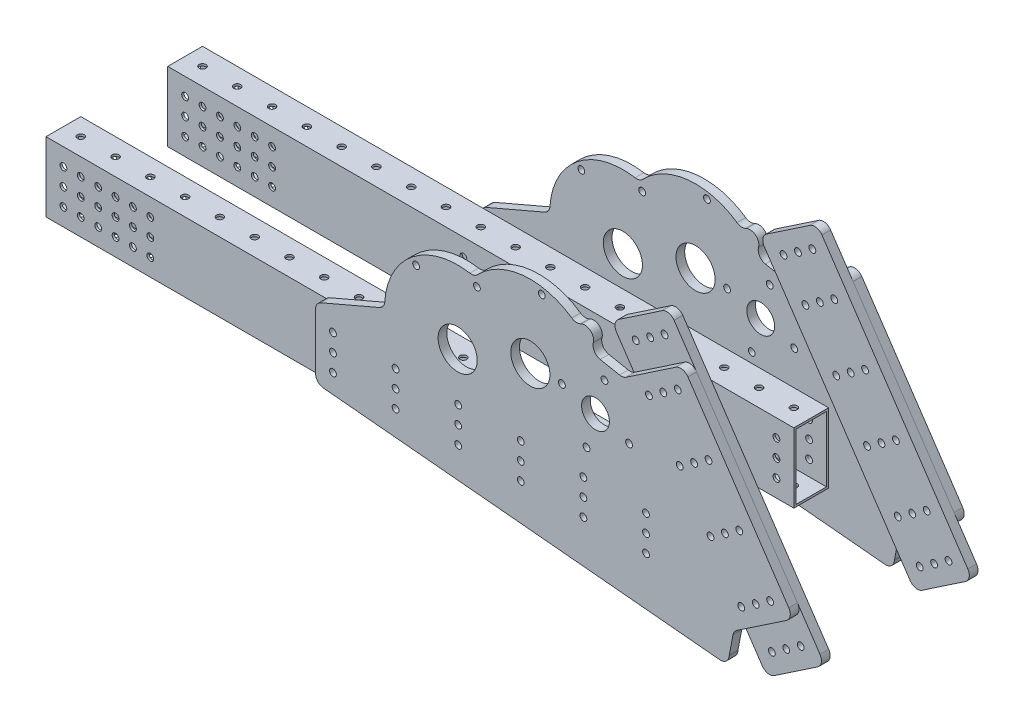
from build123d import *

# Parameters (mm, degrees)
BEARING_BLOCK_INTERFACE_PLATE_R = 2.4892
BOSS_EXTRUDE1_DEPTH             = 6.35
FILLET2_R                       = 6.35
PLATE_GB_R                      = 2.4892
PLATE_GB_R_2                    = 14.2875
PLATE_GB_R_3                    = 10.16
BOSS_EXTRUDE2_DEPTH             = 6.35
FILLET1_R                       = 6.35
TUBE_W                          = 457.2
TUBE_H                          = 50.8
BOSS_EXTRUDE3_DEPTH             = 25.4
SHELL2_T                        = -1.5875
SKETCH11_R                      = 2.4892
CUT_EXTRUDE4_DEPTH              = 696.020271071
TUBE_4_R                        = 2.4892
CUT_EXTRUDE2_DEPTH              = 773.869762832
SKETCH10_R                      = 2.4892
CUT_EXTRUDE3_DEPTH              = 774.104503156


with BuildPart() as part:
    # bearing block interface plate → Boss-Extrude1 (new body)
    with BuildSketch(Plane.XY.offset(57.15)):
        Polygon((529.051437766, 336.148394668), (571.166546451, 364.555394164), (684.794544436, 196.094959421), (642.679435751, 167.687959925), align=None)
        with Locations((646.106463048, 185.31848697)):
            Circle(BEARING_BLOCK_INTERFACE_PLATE_R, mode=Mode.SUBTRACT)
        with Locations((656.635240219, 192.420236844)):
            Circle(BEARING_BLOCK_INTERFACE_PLATE_R, mode=Mode.SUBTRACT)
        with Locations((667.164017391, 199.521986718)):
            Circle(BEARING_BLOCK_INTERFACE_PLATE_R, mode=Mode.SUBTRACT)
        with Locations((567.739519154, 346.924867119)):
            Circle(BEARING_BLOCK_INTERFACE_PLATE_R, mode=Mode.SUBTRACT)
        with Locations((557.210741982, 339.823117245)):
            Circle(BEARING_BLOCK_INTERFACE_PLATE_R, mode=Mode.SUBTRACT)
        with Locations((546.681964811, 332.721367371)):
            Circle(BEARING_BLOCK_INTERFACE_PLATE_R, mode=Mode.SUBTRACT)
        with Locations((562.660902028, 309.031618735)):
            Circle(BEARING_BLOCK_INTERFACE_PLATE_R, mode=Mode.SUBTRACT)
        with Locations((573.189679199, 316.133368609)):
            Circle(BEARING_BLOCK_INTERFACE_PLATE_R, mode=Mode.SUBTRACT)
        with Locations((583.71845637, 323.235118483)):
            Circle(BEARING_BLOCK_INTERFACE_PLATE_R, mode=Mode.SUBTRACT)
        with Locations((606.207330972, 289.893990773)):
            Circle(BEARING_BLOCK_INTERFACE_PLATE_R, mode=Mode.SUBTRACT)
        with Locations((595.6785538, 282.792240899)):
            Circle(BEARING_BLOCK_INTERFACE_PLATE_R, mode=Mode.SUBTRACT)
        with Locations((585.149776629, 275.690491025)):
            Circle(BEARING_BLOCK_INTERFACE_PLATE_R, mode=Mode.SUBTRACT)
        with Locations((628.696205573, 256.552863064)):
            Circle(BEARING_BLOCK_INTERFACE_PLATE_R, mode=Mode.SUBTRACT)
        with Locations((618.167428402, 249.45111319)):
            Circle(BEARING_BLOCK_INTERFACE_PLATE_R, mode=Mode.SUBTRACT)
        with Locations((607.63865123, 242.349363316)):
            Circle(BEARING_BLOCK_INTERFACE_PLATE_R, mode=Mode.SUBTRACT)
        with Locations((651.185080174, 223.211735354)):
            Circle(BEARING_BLOCK_INTERFACE_PLATE_R, mode=Mode.SUBTRACT)
        with Locations((640.656303003, 216.10998548)):
            Circle(BEARING_BLOCK_INTERFACE_PLATE_R, mode=Mode.SUBTRACT)
        with Locations((630.127525831, 209.008235606)):
            Circle(BEARING_BLOCK_INTERFACE_PLATE_R, mode=Mode.SUBTRACT)
    extrude(amount=-BOSS_EXTRUDE1_DEPTH)

    # Fillet2
    fillet2_edges = [part.edges().sort_by_distance(p)[0] for p in [
        (642.679435751, 167.687959925, 53.975),
        (571.166546451, 364.555394164, 53.975),
        (529.051437766, 336.148394668, 53.975),
        (684.794544436, 196.094959421, 53.975),
    ]]
    fillet(fillet2_edges, radius=FILLET2_R)


with BuildPart() as body_2:
    # plate+gb → Boss-Extrude2 (new body)
    with BuildSketch(Plane.XY.offset(63.5)):
        with BuildLine():
            Line((319.237342332, 246.126), (319.237342332, 195.326))
            Line((319.237342332, 195.326), (627.129512771, 166.477179286))
            ThreePointArc((627.129512771, 166.477179286), (622.555505171, 169.035259751), (621.371649855, 174.140532299))
            Line((621.371649855, 174.140532299), (623.889276442, 187.327918834))
            Line((623.889276442, 187.327918834), (624.075421765, 188.302952357))
            ThreePointArc((624.075421765, 188.302952357), (625.011743382, 190.608109349), (626.761896857, 192.376557749))
            Line((626.761896857, 192.376557749), (668.371747852, 220.44275663))
            Line((668.371747852, 220.44275663), (587.589343035, 340.207596955))
            Line((587.589343035, 340.207596955), (545.979492039, 312.141398074))
            ThreePointArc((545.979492039, 312.141398074), (543.684196204, 311.18115646), (541.196139608, 311.176541181))
            Line((541.196139608, 311.176541181), (540.222373002, 311.36920423))
            Line((540.222373002, 311.36920423), (527.052121603, 313.974983453))
            ThreePointArc((527.052121603, 313.974983453), (522.79804256, 316.926147758), (522.065562756, 322.05157775))
            ThreePointArc((522.065562756, 322.05157775), (520.117459336, 328.526714762), (513.437327672, 329.574735381))
            Line((513.437327672, 329.574735381), (509.130838224, 327.724214652))
            ThreePointArc((509.130838224, 327.724214652), (470.697933856, 338.939139441), (435.288517283, 320.256637088))
            ThreePointArc((435.288517283, 320.256637088), (389.695116812, 310.014081601), (369.664819812, 267.794947177))
            Line((369.664819812, 267.794947177), (319.237342332, 246.126))
        make_face()
        with Locations((630.127525831, 209.008235606)):
            Circle(PLATE_GB_R, mode=Mode.SUBTRACT)
        with Locations((517.084105797, 253.341484012)):
            Circle(PLATE_GB_R, mode=Mode.SUBTRACT)
        with Locations((640.656303003, 216.10998548)):
            Circle(PLATE_GB_R, mode=Mode.SUBTRACT)
        with Locations((651.185080174, 223.211735354)):
            Circle(PLATE_GB_R, mode=Mode.SUBTRACT)
        with Locations((607.63865123, 242.349363316)):
            Circle(PLATE_GB_R, mode=Mode.SUBTRACT)
        with Locations((618.167428402, 249.45111319)):
            Circle(PLATE_GB_R, mode=Mode.SUBTRACT)
        with Locations((423.001921395, 268.351)):
            Circle(PLATE_GB_R_2, mode=Mode.SUBTRACT)
        with Locations((476.064764939, 285.869819452)):
            Circle(PLATE_GB_R_2, mode=Mode.SUBTRACT)
        with Locations((392.66893865, 306.294163601)):
            Circle(PLATE_GB_R, mode=Mode.SUBTRACT)
        with Locations((437.075083787, 314.845296495)):
            Circle(PLATE_GB_R, mode=Mode.SUBTRACT)
        with Locations((484.430372533, 333.721570892)):
            Circle(PLATE_GB_R, mode=Mode.SUBTRACT)
        with Locations((548.192625531, 271.301996254)):
            Circle(PLATE_GB_R, mode=Mode.SUBTRACT)
        with Locations((499.123593555, 284.450003746)):
            Circle(PLATE_GB_R, mode=Mode.SUBTRACT)
        with Locations((523.658109543, 277.876)):
            Circle(PLATE_GB_R_3, mode=Mode.SUBTRACT)
        with Locations((628.696205573, 256.552863064)):
            Circle(PLATE_GB_R, mode=Mode.SUBTRACT)
        with Locations((585.149776629, 275.690491025)):
            Circle(PLATE_GB_R, mode=Mode.SUBTRACT)
        with Locations((595.6785538, 282.792240899)):
            Circle(PLATE_GB_R, mode=Mode.SUBTRACT)
        with Locations((606.207330972, 289.893990773)):
            Circle(PLATE_GB_R, mode=Mode.SUBTRACT)
        with Locations((530.232113289, 302.410515988)):
            Circle(PLATE_GB_R, mode=Mode.SUBTRACT)
        with Locations((562.660902028, 309.031618735)):
            Circle(PLATE_GB_R, mode=Mode.SUBTRACT)
        with Locations((573.189679199, 316.133368609)):
            Circle(PLATE_GB_R, mode=Mode.SUBTRACT)
        with Locations((583.71845637, 323.235118483)):
            Circle(PLATE_GB_R, mode=Mode.SUBTRACT)
    extrude(amount=-BOSS_EXTRUDE2_DEPTH)

    # Fillet1
    fillet1_edges = [body_2.edges().sort_by_distance(p)[0] for p in [
        (668.371747852, 220.44275663, 60.325),
        (587.589343035, 340.207596955, 60.325),
        (319.237342332, 195.326, 60.325),
        (627.129512771, 166.477179286, 60.325),
        (435.288517283, 320.256637088, 60.325),
        (369.664819812, 267.794947177, 60.325),
        (509.130838224, 327.724214652, 60.325),
        (319.237342332, 246.126, 60.325),
    ]]
    fillet(fillet1_edges, radius=FILLET1_R)

    # Sketch10 → Cut-Extrude3 (cut, through all)
    with BuildSketch(Plane.XY.offset(63.5)):
        with Locations((469.097342332, 208.026)):
            Circle(SKETCH10_R)
        with Locations((423.377342332, 208.026)):
            Circle(SKETCH10_R)
        with Locations((377.657342332, 208.026)):
            Circle(SKETCH10_R)
        with Locations((331.937342332, 208.026)):
            Circle(SKETCH10_R)
        with Locations((331.937342332, 220.726)):
            Circle(SKETCH10_R)
        with Locations((377.657342332, 220.726)):
            Circle(SKETCH10_R)
        with Locations((423.377342332, 220.726)):
            Circle(SKETCH10_R)
        with Locations((469.097342332, 220.726)):
            Circle(SKETCH10_R)
        with Locations((514.817342332, 220.726)):
            Circle(SKETCH10_R)
        with Locations((514.817342332, 208.026)):
            Circle(SKETCH10_R)
        with Locations((560.537342332, 208.026)):
            Circle(SKETCH10_R)
        with Locations((560.537342332, 220.726)):
            Circle(SKETCH10_R)
        with Locations((560.537342332, 233.426)):
            Circle(SKETCH10_R)
        with Locations((514.817342332, 233.426)):
            Circle(SKETCH10_R)
        with Locations((469.097342332, 233.426)):
            Circle(SKETCH10_R)
        with Locations((423.377342332, 233.426)):
            Circle(SKETCH10_R)
        with Locations((377.657342332, 233.426)):
            Circle(SKETCH10_R)
        with Locations((331.937342332, 233.426)):
            Circle(SKETCH10_R)
    extrude(amount=-CUT_EXTRUDE3_DEPTH, mode=Mode.SUBTRACT)


with BuildPart() as body_3:
    # tube → Boss-Extrude3 (new body)
    with BuildSketch(Plane.XY.offset(57.15)):
        with Locations((344.637342332, 220.726)):
            Rectangle(TUBE_W, TUBE_H)
    extrude(amount=-BOSS_EXTRUDE3_DEPTH)

    # Shell2
    shell2_openings = [body_3.faces().sort_by_distance(p)[0] for p in [
        (573.237342332, 220.726, 44.45),
        (116.037342332, 220.726, 44.45),
    ]]
    offset(amount=SHELL2_T, openings=shell2_openings, kind=Kind.INTERSECTION)

    # Sketch11 → Cut-Extrude4 (cut, through all)
    with BuildSketch(Plane(origin=(0, 246.126, 0), x_dir=(1, 0, 0), z_dir=(0, 1, 0))):
        with Locations((560.537342332, -44.45)):
            Circle(SKETCH11_R)
        with Locations((535.137342332, -44.45)):
            Circle(SKETCH11_R)
        with Locations((509.737342332, -44.45)):
            Circle(SKETCH11_R)
        with Locations((484.337342332, -44.45)):
            Circle(SKETCH11_R)
        with Locations((458.937342332, -44.45)):
            Circle(SKETCH11_R)
        with Locations((433.537342332, -44.45)):
            Circle(SKETCH11_R)
        with Locations((408.137342332, -44.45)):
            Circle(SKETCH11_R)
        with Locations((382.737342332, -44.45)):
            Circle(SKETCH11_R)
        with Locations((357.337342332, -44.45)):
            Circle(SKETCH11_R)
        with Locations((331.937342332, -44.45)):
            Circle(SKETCH11_R)
        with Locations((306.537342332, -44.45)):
            Circle(SKETCH11_R)
        with Locations((281.137342332, -44.45)):
            Circle(SKETCH11_R)
        with Locations((255.737342332, -44.45)):
            Circle(SKETCH11_R)
        with Locations((230.337342332, -44.45)):
            Circle(SKETCH11_R)
        with Locations((204.937342332, -44.45)):
            Circle(SKETCH11_R)
        with Locations((179.537342332, -44.45)):
            Circle(SKETCH11_R)
        with Locations((154.137342332, -44.45)):
            Circle(SKETCH11_R)
        with Locations((128.737342332, -44.45)):
            Circle(SKETCH11_R)
    extrude(amount=-CUT_EXTRUDE4_DEPTH, mode=Mode.SUBTRACT)

    # tube<4> → Cut-Extrude2 (cut, through all)
    with BuildSketch(Plane.XY.offset(57.15)):
        with Locations((560.537342332, 220.726)):
            Circle(TUBE_4_R)
        with Locations((560.537342332, 208.026)):
            Circle(TUBE_4_R)
        with Locations((560.537342332, 233.426)):
            Circle(TUBE_4_R)
        with Locations((514.817342332, 208.026)):
            Circle(TUBE_4_R)
        with Locations((514.817342332, 220.726)):
            Circle(TUBE_4_R)
        with Locations((514.817342332, 233.426)):
            Circle(TUBE_4_R)
        with Locations((469.097342332, 208.026)):
            Circle(TUBE_4_R)
        with Locations((469.097342332, 220.726)):
            Circle(TUBE_4_R)
        with Locations((469.097342332, 233.426)):
            Circle(TUBE_4_R)
        with Locations((423.377342332, 208.026)):
            Circle(TUBE_4_R)
        with Locations((423.377342332, 220.726)):
            Circle(TUBE_4_R)
        with Locations((423.377342332, 233.426)):
            Circle(TUBE_4_R)
        with Locations((377.657342332, 208.026)):
            Circle(TUBE_4_R)
        with Locations((377.657342332, 220.726)):
            Circle(TUBE_4_R)
        with Locations((377.657342332, 233.426)):
            Circle(TUBE_4_R)
        with Locations((331.937342332, 208.026)):
            Circle(TUBE_4_R)
        with Locations((331.937342332, 220.726)):
            Circle(TUBE_4_R)
        with Locations((331.937342332, 233.426)):
            Circle(TUBE_4_R)
        with Locations((128.737342332, 220.726)):
            Circle(TUBE_4_R)
        with Locations((128.737342332, 208.026)):
            Circle(TUBE_4_R)
        with Locations((128.737342332, 233.426)):
            Circle(TUBE_4_R)
        with Locations((141.437342332, 220.726)):
            Circle(TUBE_4_R)
        with Locations((141.437342332, 208.026)):
            Circle(TUBE_4_R)
        with Locations((141.437342332, 233.426)):
            Circle(TUBE_4_R)
        with Locations((154.137342332, 220.726)):
            Circle(TUBE_4_R)
        with Locations((154.137342332, 208.026)):
            Circle(TUBE_4_R)
        with Locations((154.137342332, 233.426)):
            Circle(TUBE_4_R)
        with Locations((166.837342332, 220.726)):
            Circle(TUBE_4_R)
        with Locations((166.837342332, 208.026)):
            Circle(TUBE_4_R)
        with Locations((166.837342332, 233.426)):
            Circle(TUBE_4_R)
        with Locations((179.537342332, 220.726)):
            Circle(TUBE_4_R)
        with Locations((179.537342332, 208.026)):
            Circle(TUBE_4_R)
        with Locations((179.537342332, 233.426)):
            Circle(TUBE_4_R)
        with Locations((192.237342332, 220.726)):
            Circle(TUBE_4_R)
        with Locations((192.237342332, 208.026)):
            Circle(TUBE_4_R)
        with Locations((192.237342332, 233.426)):
            Circle(TUBE_4_R)
    extrude(amount=-CUT_EXTRUDE2_DEPTH, mode=Mode.SUBTRACT)


with BuildPart() as body_4:
    # Mirror1: mirrored copy
    add(body_2.part.mirror(Plane.XY))


with BuildPart() as body_5:
    # Mirror1 2: mirrored copy
    add(body_3.part.mirror(Plane.XY))


with BuildPart() as body_6:
    # Mirror1 3: mirrored copy
    add(part.part.mirror(Plane.XY))


solid = Compound([part.part, body_2.part, body_3.part, body_4.part, body_5.part, body_6.part])
